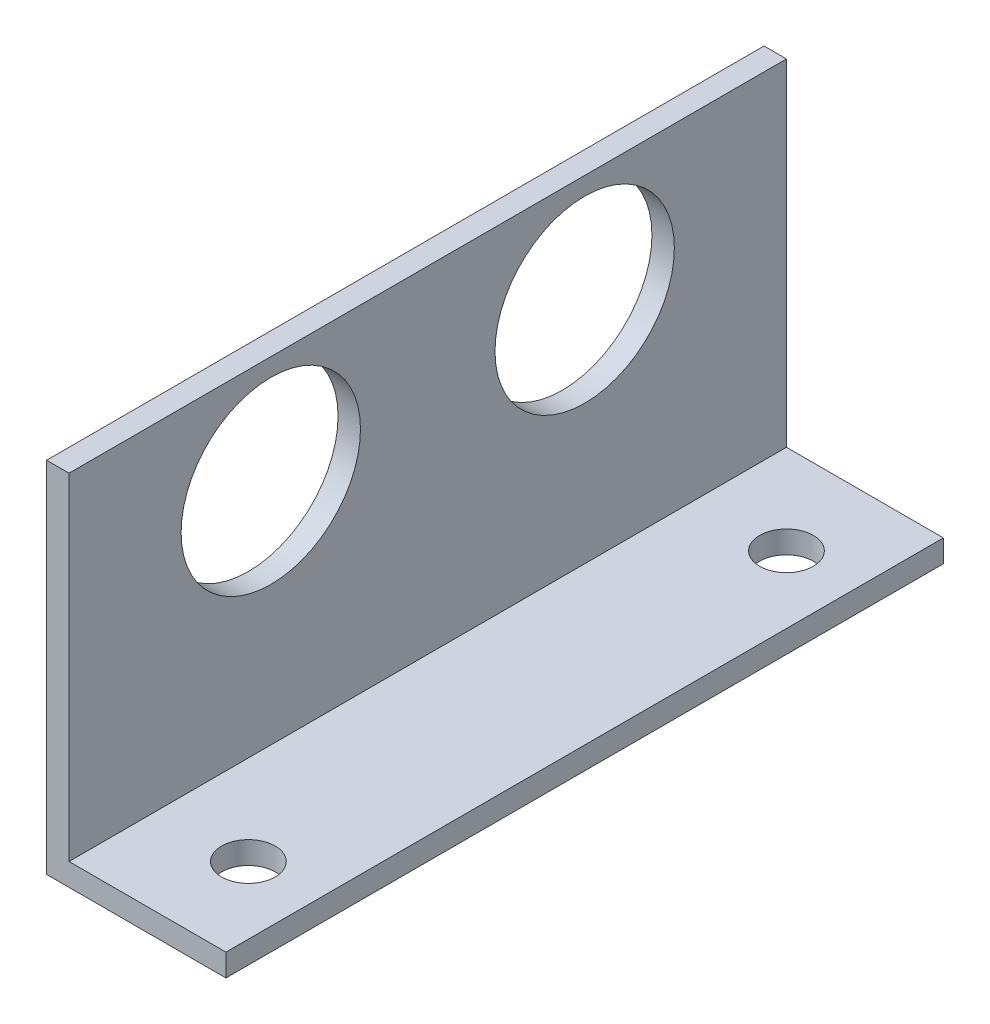
from build123d import *

# Parameters (mm, degrees)
BOSS_EXTRUDE1_DEPTH       = 25.4
SKETCH3_R                 = 6.35
CUT_EXTRUDE1_DEPTH        = 39.1
F_6_CLEARANCE_HOLE1_D     = 3.7973
F_6_CLEARANCE_HOLE1_DEPTH = 3.175
F_6_CLEARANCE_HOLE1_TIP   = 1.140824014


with BuildPart() as part:
    # Sketch1 → Boss-Extrude1 (new, symmetric)
    with BuildSketch(Plane.XY):
        Polygon((0, 0), (12.7, 0), (12.7, 1.5875), (1.5875, 1.5875), (1.5875, 25.4), (0, 25.4), align=None)
    extrude(amount=BOSS_EXTRUDE1_DEPTH, both=True)

    # Sketch3 → Cut-Extrude1 (cut, through all)
    with BuildSketch(Plane.ZY):
        with Locations((11.1125, 17.78)):
            Circle(SKETCH3_R)
        with Locations((-11.1125, 17.78)):
            Circle(SKETCH3_R)
    extrude(amount=-CUT_EXTRUDE1_DEPTH, mode=Mode.SUBTRACT)

    # #6 Clearance Hole1
    with Locations(Plane(origin=(0, 1.5875, 0), x_dir=(1, 0, 0), z_dir=(0, 1, 0))):
        with Locations((7.9375, 19.05), (7.9375, -19.05)):
            Hole(F_6_CLEARANCE_HOLE1_D / 2, depth=F_6_CLEARANCE_HOLE1_DEPTH)
            with Locations((0, 0, -(F_6_CLEARANCE_HOLE1_DEPTH + F_6_CLEARANCE_HOLE1_TIP / 2))):  # 118° drill point
                Cone(0, F_6_CLEARANCE_HOLE1_D / 2, F_6_CLEARANCE_HOLE1_TIP, mode=Mode.SUBTRACT)


solid = part.part
